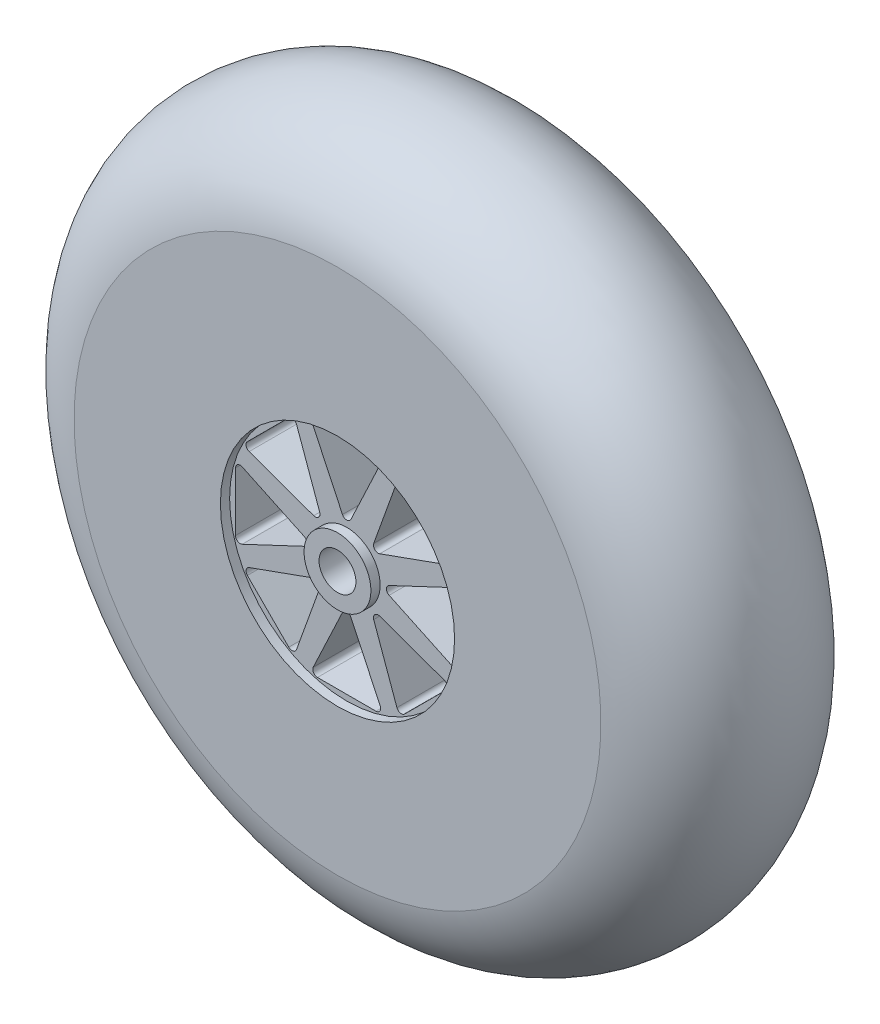
from build123d import *

# Parameters (mm, degrees)
SKETCH2_R          = 12.7
SKETCH2_R_2        = 3.625
CUT_EXTRUDE1_DEPTH = 1
CUT_EXTRUDE2_DEPTH = 9.525


with BuildPart() as part:
    # Sketch1 → Revolve1 (revolve)
    with BuildSketch(Plane(origin=(0, 0, 0), x_dir=(0, 0, -1), z_dir=(1, 0, 0))):
        with BuildLine():
            Line((0, 28.575), (0, 2))
            Line((0, 2), (22.225, 2))
            Line((22.225, 2), (22.225, 28.575))
            ThreePointArc((22.225, 28.575), (11.1125, 38.1), (0, 28.575))
        make_face()
    revolve(axis=Axis((0, 0, -22.225), (0, 0, 1)))

    # Sketch2 → Cut-Extrude1 (cut)
    with BuildSketch(Plane.XY):
        Circle(SKETCH2_R)
        Circle(SKETCH2_R_2, mode=Mode.SUBTRACT)
    extrude(amount=-CUT_EXTRUDE1_DEPTH, mode=Mode.SUBTRACT)

    # Sketch3 → Cut-Extrude2 (cut)
    with BuildSketch(Plane.XY.offset(-1)):
        with BuildLine():
            Line((-0.459525068, 4.600054071), (-3.634525068, 11.337002474))
            ThreePointArc((-3.634525068, 11.337002474), (-3.603998477, 11.825642279), (-3.175, 12.061568196))
            Line((-3.175, 12.061568196), (3.175, 12.061568196))
            ThreePointArc((3.175, 12.061568196), (3.603998477, 11.825642279), (3.634525068, 11.337002474))
            Line((3.634525068, 11.337002474), (0.459525068, 4.600054071))
            ThreePointArc((0.459525068, 4.600054071), (0, 4.308619792), (-0.459525068, 4.600054071))
        make_face()
        with BuildLine():
            Line((3.577662719, 2.927796135), (10.58646865, 5.446474006))
            ThreePointArc((10.58646865, 5.446474006), (10.91040361, 5.813580085), (10.773880693, 6.283752633))
            Line((10.773880693, 6.283752633), (6.283752633, 10.773880693))
            ThreePointArc((6.283752633, 10.773880693), (5.813580085, 10.91040361), (5.446474006, 10.58646865))
            Line((5.446474006, 10.58646865), (2.927796135, 3.577662719))
            ThreePointArc((2.927796135, 3.577662719), (3.046654273, 3.046654273), (3.577662719, 2.927796135))
        make_face()
        with BuildLine():
            Line((4.600054071, -0.459525068), (11.337002474, -3.634525068))
            ThreePointArc((11.337002474, -3.634525068), (11.825642279, -3.603998477), (12.061568196, -3.175))
            Line((12.061568196, -3.175), (12.061568196, 3.175))
            ThreePointArc((12.061568196, 3.175), (11.825642279, 3.603998477), (11.337002474, 3.634525068))
            Line((11.337002474, 3.634525068), (4.600054071, 0.459525068))
            ThreePointArc((4.600054071, 0.459525068), (4.308619792, 0), (4.600054071, -0.459525068))
        make_face()
        with BuildLine():
            Line((2.927796135, -3.577662719), (5.446474006, -10.58646865))
            ThreePointArc((5.446474006, -10.58646865), (5.813580085, -10.91040361), (6.283752633, -10.773880693))
            Line((6.283752633, -10.773880693), (10.773880693, -6.283752633))
            ThreePointArc((10.773880693, -6.283752633), (10.91040361, -5.813580085), (10.58646865, -5.446474006))
            Line((10.58646865, -5.446474006), (3.577662719, -2.927796135))
            ThreePointArc((3.577662719, -2.927796135), (3.046654273, -3.046654273), (2.927796135, -3.577662719))
        make_face()
        with BuildLine():
            Line((-0.459525068, -4.600054071), (-3.634525068, -11.337002474))
            ThreePointArc((-3.634525068, -11.337002474), (-3.603998477, -11.825642279), (-3.175, -12.061568196))
            Line((-3.175, -12.061568196), (3.175, -12.061568196))
            ThreePointArc((3.175, -12.061568196), (3.603998477, -11.825642279), (3.634525068, -11.337002474))
            Line((3.634525068, -11.337002474), (0.459525068, -4.600054071))
            ThreePointArc((0.459525068, -4.600054071), (0, -4.308619792), (-0.459525068, -4.600054071))
        make_face()
        with BuildLine():
            Line((-3.577662719, -2.927796135), (-10.58646865, -5.446474006))
            ThreePointArc((-10.58646865, -5.446474006), (-10.91040361, -5.813580085), (-10.773880693, -6.283752633))
            Line((-10.773880693, -6.283752633), (-6.283752633, -10.773880693))
            ThreePointArc((-6.283752633, -10.773880693), (-5.813580085, -10.91040361), (-5.446474006, -10.58646865))
            Line((-5.446474006, -10.58646865), (-2.927796135, -3.577662719))
            ThreePointArc((-2.927796135, -3.577662719), (-3.046654273, -3.046654273), (-3.577662719, -2.927796135))
        make_face()
        with BuildLine():
            Line((-4.600054071, 0.459525068), (-11.337002474, 3.634525068))
            ThreePointArc((-11.337002474, 3.634525068), (-11.825642279, 3.603998477), (-12.061568196, 3.175))
            Line((-12.061568196, 3.175), (-12.061568196, -3.175))
            ThreePointArc((-12.061568196, -3.175), (-11.825642279, -3.603998477), (-11.337002474, -3.634525068))
            Line((-11.337002474, -3.634525068), (-4.600054071, -0.459525068))
            ThreePointArc((-4.600054071, -0.459525068), (-4.308619792, 0), (-4.600054071, 0.459525068))
        make_face()
        with BuildLine():
            Line((-2.927796135, 3.577662719), (-5.446474006, 10.58646865))
            ThreePointArc((-5.446474006, 10.58646865), (-5.813580085, 10.91040361), (-6.283752633, 10.773880693))
            Line((-6.283752633, 10.773880693), (-10.773880693, 6.283752633))
            ThreePointArc((-10.773880693, 6.283752633), (-10.91040361, 5.813580085), (-10.58646865, 5.446474006))
            Line((-10.58646865, 5.446474006), (-3.577662719, 2.927796135))
            ThreePointArc((-3.577662719, 2.927796135), (-3.046654273, 3.046654273), (-2.927796135, 3.577662719))
        make_face()
    extrude(amount=-CUT_EXTRUDE2_DEPTH, mode=Mode.SUBTRACT)


solid = part.part
